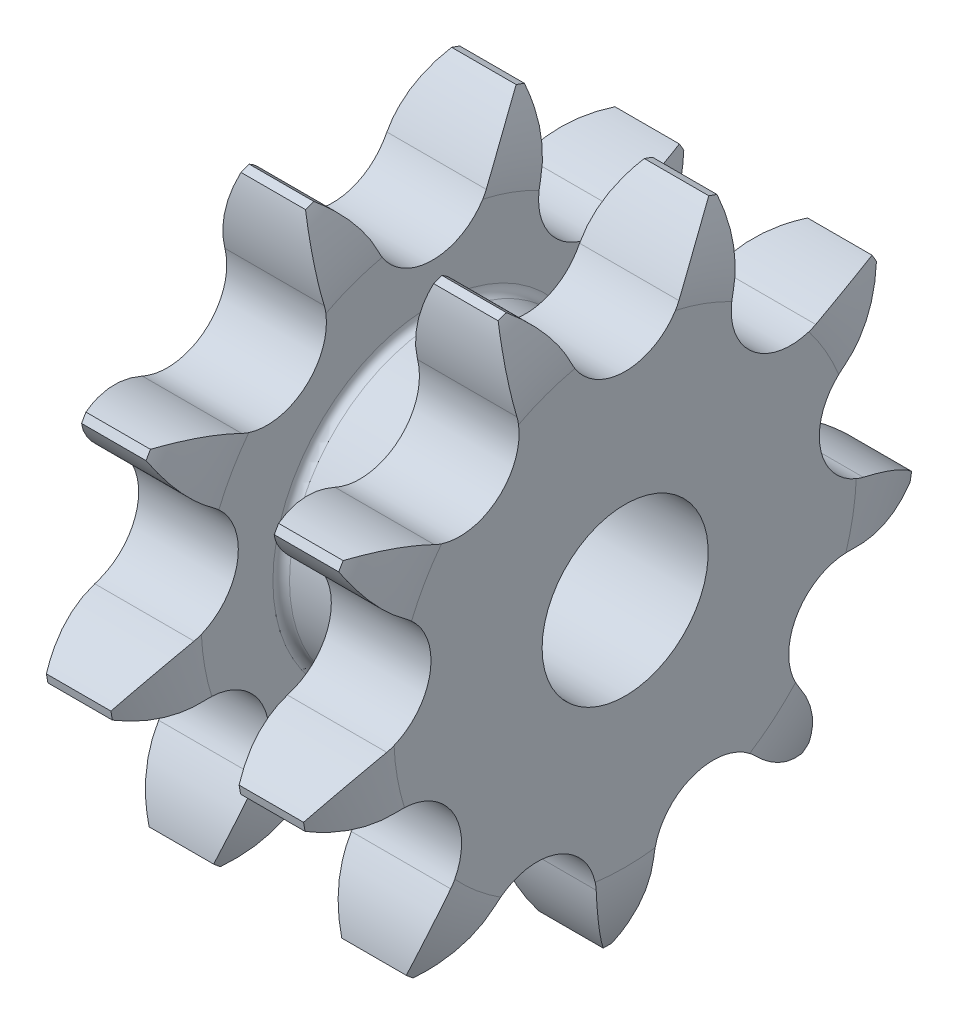
from build123d import *

# Parameters (mm, degrees)
TOOTHCUT_DEPTH  = 38.895381805
TEETHCUTS_COUNT = 9
TEETHCUTS_ANGLE = 320
BORSKE_R        = 6
BORE_DEPTH      = 23.3205


with BuildPart() as part:
    # BasProSke → Base-Revolve (revolve)
    with BuildSketch(Plane(origin=(0, 0, 0), x_dir=(1, 0, 0), z_dir=(0, 1, 0))):
        with BuildLine():
            Line((0, 0), (0, 16.712856303))
            ThreePointArc((0, 16.712856303), (0.321571182, 19.552662635), (1.27, 22.248657961))
            Line((1.27, 22.248657961), (19.85, 22.248657961))
            ThreePointArc((19.85, 22.248657961), (20.798428818, 19.552662635), (21.12, 16.712856303))
            Line((21.12, 16.712856303), (21.12, 0))
            Line((21.12, 0), (0, 0))
        make_face()
    revolve(axis=Axis((-10, 0, 0), (1, 0, 0)))

    # GrvSke → Groove (revolve, cut)
    with BuildSketch(Plane(origin=(0, 0, 0), x_dir=(1, 0, 0), z_dir=(0, 1, 0))):
        with BuildLine():
            Line((7.2, 16.712856303), (7.2, 11.530481635))
            ThreePointArc((7.2, 11.530481635), (7.375735931, 11.106217566), (7.8, 10.930481635))
            Line((7.8, 10.930481635), (13.32, 10.930481635))
            ThreePointArc((13.32, 10.930481635), (13.744264069, 11.106217566), (13.92, 11.530481635))
            Line((13.92, 11.530481635), (13.92, 16.712856303))
            ThreePointArc((13.92, 16.712856303), (14.241571182, 19.552662635), (15.19, 22.248657961))
            Line((15.19, 22.248657961), (5.93, 22.248657961))
            ThreePointArc((5.93, 22.248657961), (6.878428818, 19.552662635), (7.2, 16.712856303))
        make_face()
    revolve(axis=Axis((0, 0, 0), (1, 0, 0)), mode=Mode.SUBTRACT)

    # TooCutSke → ToothCut (cut, through all)
    with BuildSketch(Plane(origin=(0, 0, 0), x_dir=(0, 0, -1), z_dir=(1, 0, 0))):
        with BuildLine():
            ThreePointArc((3.89490303, 16.792484851), (5.53909395, 19.346647696), (7.807509589, 21.366895728))
            ThreePointArc((7.807509589, 21.366895728), (0, 22.748657961), (-7.807509589, 21.366895728))
            ThreePointArc((-7.807509589, 21.366895728), (-5.53909395, 19.346647696), (-3.89490303, 16.792484851))
            ThreePointArc((-3.89490303, 16.792484851), (0, 14.311157961), (3.89490303, 16.792484851))
        make_face()
    toothcut = extrude(amount=TOOTHCUT_DEPTH, mode=Mode.SUBTRACT)

    # TeethCuts: ToothCut ×9 about axis
    teethcuts_axis = Axis((-10, 0, 0), (1, 0, 0))
    for i in range(1, TEETHCUTS_COUNT):
        add(toothcut.rotate(teethcuts_axis, i * TEETHCUTS_ANGLE / (TEETHCUTS_COUNT - 1)), mode=Mode.SUBTRACT)

    # BorSke → Bore (cut, symmetric)
    with BuildSketch(Plane(origin=(0, 0, 0), x_dir=(0, 0, -1), z_dir=(1, 0, 0))):
        Circle(BORSKE_R)
    extrude(amount=BORE_DEPTH, both=True, mode=Mode.SUBTRACT)


solid = part.part
